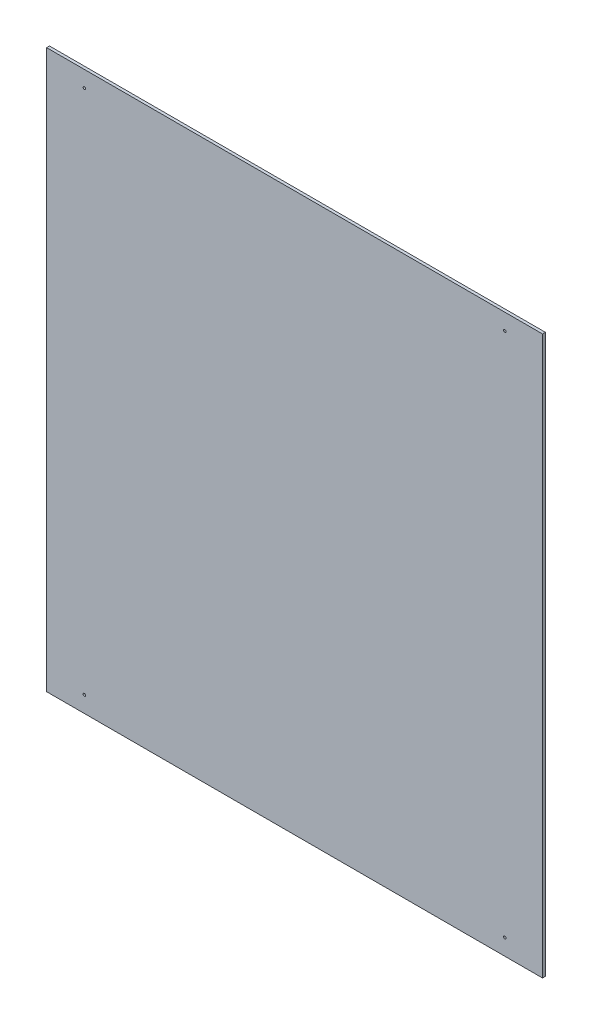
from build123d import *

# Parameters (mm, degrees)
SKETCH1_W               = 400
SKETCH1_H               = 450
BASE_FLANGE1_DEPTH      = 2.3
SKETCH5_R               = 1
CUT_EXTRUDE4_DEPTH      = 302.048650553
MIRROR4_COPY_1_SKETCH_R = 1
MIRROR4_COPY_1_DEPTH    = 302.048650553


# Sheet-metal steps are written as plain solids
with BuildPart() as part:
    # Sketch1 → Base-Flange1 (new body)
    with BuildSketch(Plane.XY):
        Rectangle(SKETCH1_W, SKETCH1_H)
    extrude(amount=-BASE_FLANGE1_DEPTH)

    # Sketch5 → Cut-Extrude4 (cut, through all)
    with BuildSketch(Plane.XY):
        with Locations((169.61, 211.94)):
            Circle(SKETCH5_R)
    cut_extrude4 = extrude(amount=-CUT_EXTRUDE4_DEPTH, mode=Mode.SUBTRACT)

    # Mirror3: Cut-Extrude4 across plane
    add(cut_extrude4.mirror(Plane.ZX), mode=Mode.SUBTRACT)

    # Mirror4: Cut-Extrude4 across plane
    add(cut_extrude4.mirror(Plane(origin=(0, 0, 0), x_dir=(0, 0, 1), z_dir=(1, 0, 0))), mode=Mode.SUBTRACT)

    # Mirror4 copy 1 sketch → Mirror4 copy 1 (cut, through all)
    with BuildSketch(Plane(origin=(0, 0, 0), x_dir=(-1, 0, 0), z_dir=(0, 0, 1))):
        with Locations((169.61, 211.94)):
            Circle(MIRROR4_COPY_1_SKETCH_R)
    extrude(amount=-MIRROR4_COPY_1_DEPTH, mode=Mode.SUBTRACT)


solid = part.part
